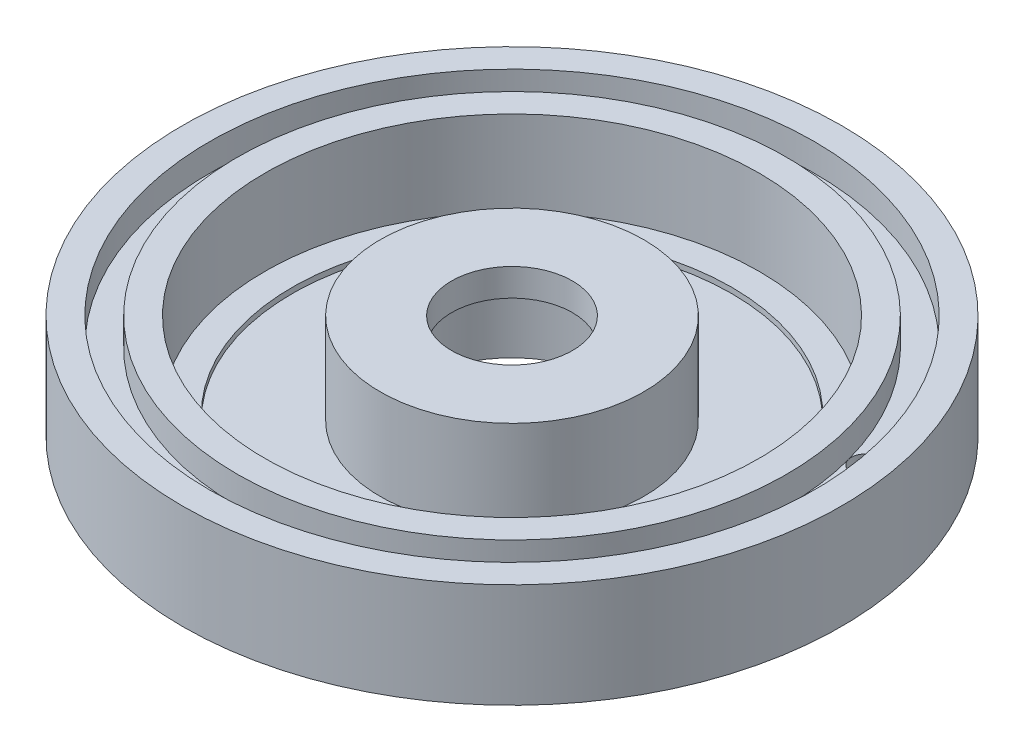
from build123d import *

# Parameters (mm, degrees)
SKETCH1_R             = 60
BOSS_EXTRUDE1_DEPTH   = 19
SKETCH2_R             = 55
SKETCH2_R_2           = 50
CUT_EXTRUDE1_DEPTH    = 5
SKETCH6_W             = 17.5
SKETCH6_H             = 14
M6_TAPPED_HOLE1_D     = 5
M6_TAPPED_HOLE1_DEPTH = 15
M6_TAPPED_HOLE1_TIP   = 1.502151548


with BuildPart() as part:
    # Sketch1 → Boss-Extrude1 (new body)
    with BuildSketch(Plane(origin=(0, 0, 0), x_dir=(1, 0, 0), z_dir=(0, 1, 0))):
        Circle(SKETCH1_R)
    extrude(amount=BOSS_EXTRUDE1_DEPTH)

    # Sketch2 → Cut-Extrude1 (cut)
    with BuildSketch(Plane(origin=(0, 19, 0), x_dir=(1, 0, 0), z_dir=(0, 1, 0))):
        Circle(SKETCH2_R)
        Circle(SKETCH2_R_2, mode=Mode.SUBTRACT)
    extrude(amount=-CUT_EXTRUDE1_DEPTH, mode=Mode.SUBTRACT)

    # Sketch4 → Cut-Revolve1 (revolve, cut)
    with BuildSketch(Plane.XY):
        Polygon((45, 19), (45, 3.5), (40, 3.5), (40, 2.5), (0, 2.5), (0, 19), align=None)
    revolve(axis=Axis((0, 0, 0), (0, 1, 0)), mode=Mode.SUBTRACT)

    # Sketch5 → Revolve1 (revolve)
    with BuildSketch(Plane.XY):
        Polygon((17.5, 0), (17.5, 14), (11, 14), (11, 19), (24, 19), (24, 0), align=None)
    revolve(axis=Axis((0, 0, 0), (0, 1, 0)))

    # Sketch6 → Cut-Revolve2 (revolve, cut)
    with BuildSketch(Plane.XY):
        with Locations((8.75, 7)):
            Rectangle(SKETCH6_W, SKETCH6_H)
    revolve(axis=Axis((0, 0, 0), (0, 1, 0)), mode=Mode.SUBTRACT)

    # M6 Tapped Hole1
    with Locations(Plane(origin=(0, 19, 0), x_dir=(1, 0, 0), z_dir=(0, 1, 0))):
        with Locations((50.71110588, 13.587999868), (50.71110588, -13.587999868)):
            Hole(M6_TAPPED_HOLE1_D / 2, depth=M6_TAPPED_HOLE1_DEPTH)
            with Locations((0, 0, -(M6_TAPPED_HOLE1_DEPTH + M6_TAPPED_HOLE1_TIP / 2))):  # 118° drill point
                Cone(0, M6_TAPPED_HOLE1_D / 2, M6_TAPPED_HOLE1_TIP, mode=Mode.SUBTRACT)


solid = part.part
